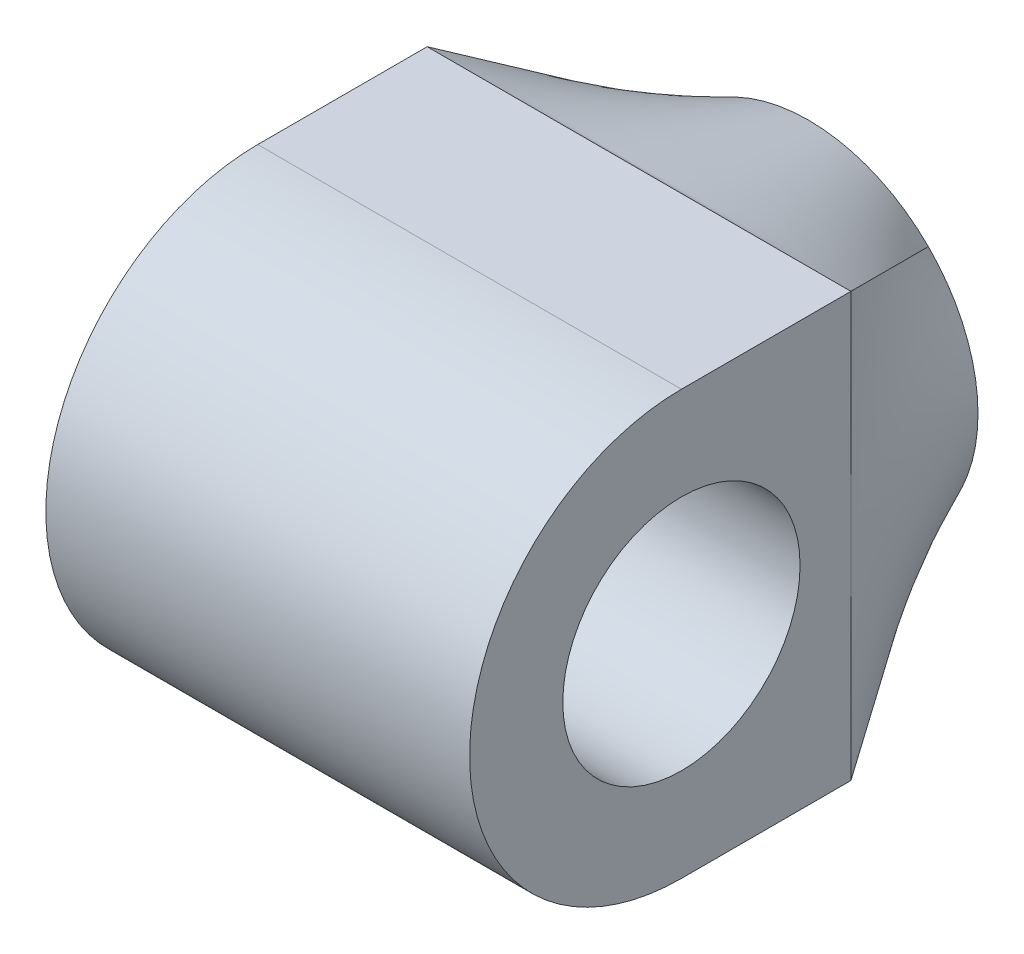
from build123d import *
from OCP.BRepAlgoAPI import BRepAlgoAPI_Cut
from OCP.TopTools import TopTools_ListOfShape

# Parameters (mm, degrees)
BOSS_EXTRUDE1_START = -12.501686
BOSS_EXTRUDE1_DEPTH = 25.003372
SKETCH4_R           = 7
CUT_EXTRUDE1_DEPTH  = 10


with BuildPart() as part:
    # Sketch2 → Loft1 section 0
    with BuildSketch(Plane.XY.offset(10)):
        with BuildLine():
            Line((-12.5, -12.5), (12.5, -12.5))
            Line((12.5, -12.5), (12.5, 12.5))
            Line((12.5, 12.5), (-12.5, 12.5))
            Line((-12.5, 12.5), (-12.5, -12.5))
        make_face()
    # Sketch1 for Loft1 → Loft1 section 1
    with BuildSketch(Plane.XY):
        with BuildLine():
            # circular arc as an exact rational Bezier (weights 1, cos(half-angle), 1)
            Bezier((-7.071067812, -7.071067812), (0, -14.142135623), (7.071067812, -7.071067812), weights=[1, 0.707106781, 1])
            Bezier((7.071067812, -7.071067812), (14.142135623, 0), (7.071067812, 7.071067812), weights=[1, 0.707106781, 1])
            Bezier((7.071067812, 7.071067812), (0, 14.142135623), (-7.071067812, 7.071067812), weights=[1, 0.707106781, 1])
            Bezier((-7.071067812, 7.071067812), (-14.142135623, 0), (-7.071067812, -7.071067812), weights=[1, 0.707106781, 1])
        make_face()
    loft()

    # Sketch3 → Boss-Extrude1 (add)
    with BuildSketch(Plane(origin=(0, 0, 0), x_dir=(0, 0, -1), z_dir=(1, 0, 0)).offset(BOSS_EXTRUDE1_START)):
        with BuildLine():
            Line((-10, 12.5), (-20, 12.5))
            ThreePointArc((-20, 12.5), (-32.5, 0), (-20, -12.5))
            Line((-20, -12.5), (-10, -12.5))
            Line((-10, -12.5), (-10, 12.5))
        make_face()
    extrude(amount=BOSS_EXTRUDE1_DEPTH)


with BuildPart() as cut_extrude1_tool:
    # Sketch4 → Cut-Extrude1 (new body)
    with BuildSketch(Plane(origin=(12.501685601, 0, 0), x_dir=(0, 0, -1), z_dir=(1, 0, 0))):
        with Locations((-20, 0)):
            Circle(SKETCH4_R)
    extrude(amount=-CUT_EXTRUDE1_DEPTH)


with BuildPart() as part_1:
    add(part.part)

    # Cut-Extrude1: cut by cut_extrude1_tool, with a tolerance
    cut_extrude1_stock = TopTools_ListOfShape()
    cut_extrude1_stock.Append(part_1.part.wrapped)
    cut_extrude1_tools = TopTools_ListOfShape()
    cut_extrude1_tools.Append(cut_extrude1_tool.part.wrapped)
    cut_extrude1_cut = BRepAlgoAPI_Cut()
    cut_extrude1_cut.SetArguments(cut_extrude1_stock)
    cut_extrude1_cut.SetTools(cut_extrude1_tools)
    cut_extrude1_cut.SetFuzzyValue(0.00001)
    cut_extrude1_cut.Build()
    add(Compound.cast(cut_extrude1_cut.Shape()).solids(), mode=Mode.REPLACE)


solid = part_1.part
